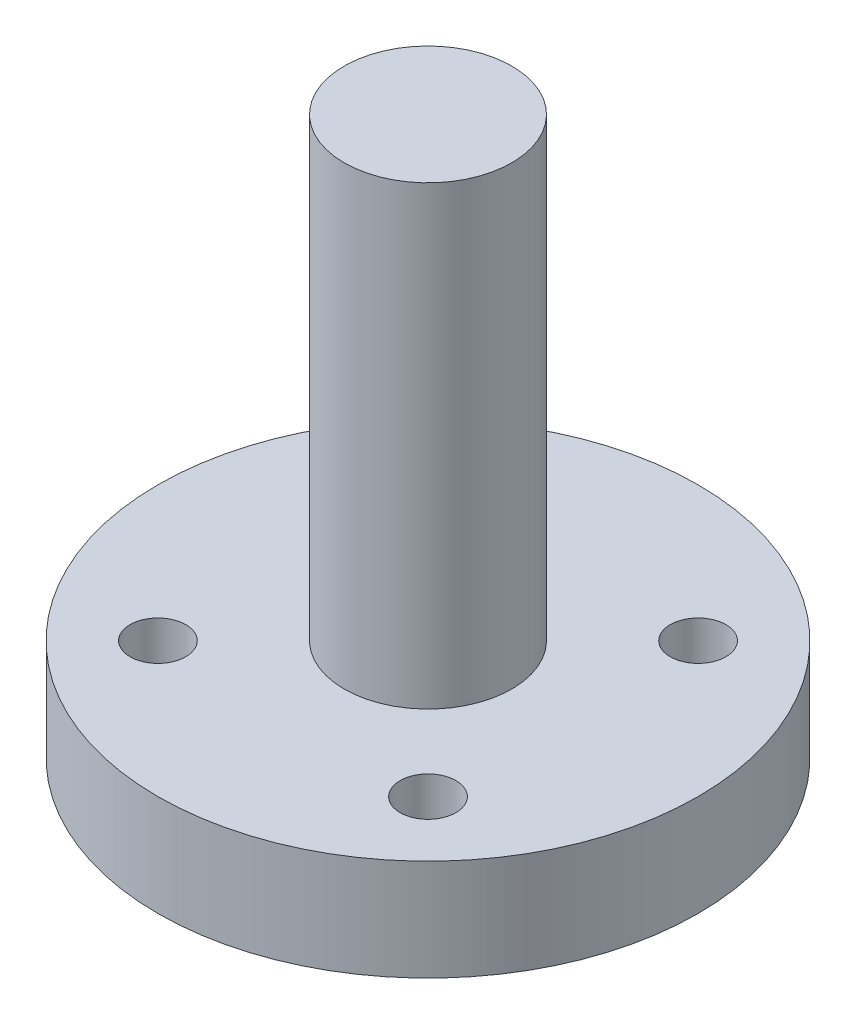
from build123d import *

# Parameters (mm, degrees)
SKETCH1_R                   = 16
BOSS_EXTRUDE1_DEPTH         = 6
TAP_DRILL_FOR_M4X0_7_TAP1_D = 3.3
SKETCH3_R                   = 4.965
BOSS_EXTRUDE2_DEPTH         = 27


with BuildPart() as part:
    # Sketch1 → Boss-Extrude1 (new body)
    with BuildSketch(Plane(origin=(0, 0, 0), x_dir=(1, 0, 0), z_dir=(0, 1, 0))):
        Circle(SKETCH1_R)
    extrude(amount=BOSS_EXTRUDE1_DEPTH)

    # Tap Drill for M4x0.7 Tap1 (through all)
    with Locations(Plane(origin=(0, 0, 0), x_dir=(-1, 0, 0), z_dir=(0, -1, 0))):
        with Locations((-8, 8), (-8, -8), (8, -8), (8, 8)):
            Hole(TAP_DRILL_FOR_M4X0_7_TAP1_D / 2)

    # Sketch3 → Boss-Extrude2 (add)
    with BuildSketch(Plane(origin=(0, 6, 0), x_dir=(1, 0, 0), z_dir=(0, 1, 0))):
        Circle(SKETCH3_R)
    extrude(amount=BOSS_EXTRUDE2_DEPTH)


solid = part.part
